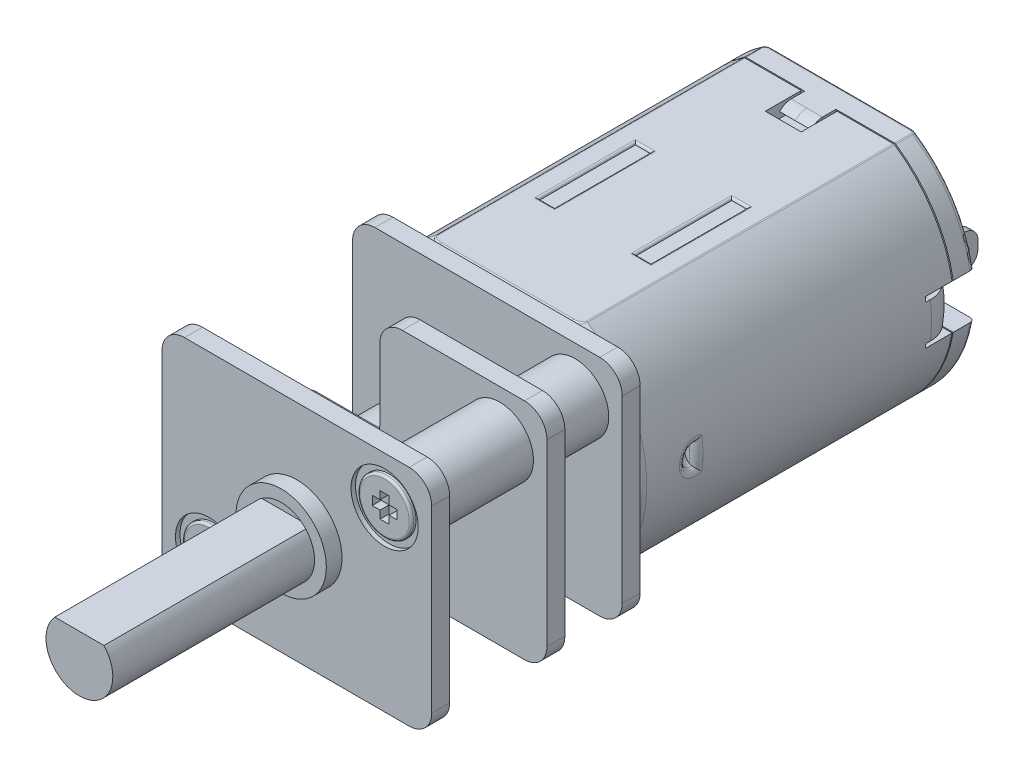
from build123d import *

# Parameters (mm, degrees)
SALIENTE_EXTRUIR2_DEPTH  = 7
SALIENTE_EXTRUIR4_DEPTH  = 0.05
SALIENTE_EXTRUIR5_DEPTH  = 0.95
REDONDEO1_R              = 0.2
CROQUIS4_R               = 2.515
SALIENTE_EXTRUIR6_DEPTH  = 1.15
CROQUIS5_R               = 1
CORTAR_EXTRUIR1_DEPTH    = 0.7
CROQUIS6_W               = 1.6
CROQUIS6_H               = 1.6
CORTAR_EXTRUIR2_DEPTH    = 0.6
CROQUIS9_W               = 1.5
CROQUIS9_H               = 2
CORTAR_EXTRUIR3_DEPTH    = 2.2
CROQUIS12_W              = 0.7
CROQUIS12_H              = 4.3
CORTAR_EXTRUIR4_DEPTH    = 0.1
REDONDEO2_R              = 0.1
CROQUIS13_W              = 0.7
CROQUIS13_H              = 4.3
CORTAR_EXTRUIR5_DEPTH    = 0.1
REDONDEO3_R              = 0.1
CORTAR_REVOLUCI_N2_ANGLE = 180
REDONDEO4_R              = 0.3
REDONDEO5_R              = 0.3
REDONDEO6_R              = 0.3
REDONDEO7_R              = 0.1
REDONDEO8_R              = 0.1
CROQUIS15_W              = 12.03
CROQUIS15_H              = 10
SALIENTE_EXTRUIR8_DEPTH  = 0.8
REDONDEO9_R              = 0.1
CROQUIS16_R              = 1.5
SALIENTE_EXTRUIR9_DEPTH  = 8.5
CROQUIS17_W              = 12.03
CROQUIS17_H              = 10
SALIENTE_EXTRUIR10_DEPTH = 0.8
SALIENTE_EXTRUIR11_DEPTH = 0.8
REDONDEO10_R             = 1
CROQUIS19_R              = 2.015
SALIENTE_EXTRUIR12_DEPTH = 0.7
SALIENTE_EXTRUIR13_START = 2.62
CROQUIS20_R              = 2.015
SALIENTE_EXTRUIR13_DEPTH = 2.62
SALIENTE_EXTRUIR14_DEPTH = 9
CORTAR_EXTRUIR6_START    = -0.2
CROQUIS22_R              = 1.5
CORTAR_EXTRUIR6_DEPTH    = 0.2
CROQUIS23_R              = 1.2
SALIENTE_EXTRUIR15_DEPTH = 0.2
CORTAR_EXTRUIR7_DEPTH    = 0.4
REDONDEO11_R             = 0.1
CORTAR_EXTRUIR8_START    = -0.2
CORTAR_EXTRUIR8_DEPTH    = 0.2
CROQUIS26_W              = 0.3
CROQUIS26_H              = 1.53
SALIENTE_EXTRUIR16_DEPTH = 2
CROQUIS27_W              = 1.2
CROQUIS27_H              = 0.73
CORTAR_EXTRUIR9_DEPTH    = 0.3
REDONDEO12_R             = 0.6
REDONDEO13_R             = 0.4
CORTAR_EXTRUIR10_DEPTH   = 0.3
REDONDEO14_R             = 0.6


# Some blends are built 0.0001 mm under size
with BuildPart() as part:
    # Croquis1 → Saliente-Extruir2 (new, symmetric)
    with BuildSketch(Plane.XY):
        with BuildLine():
            Line((-3.343684345, 5), (3.343684345, 5))
            ThreePointArc((3.343684345, 5), (6.015, 0), (3.343684345, -5))
            Line((3.343684345, -5), (-3.343684345, -5))
            ThreePointArc((-3.343684345, -5), (-6.015, 0), (-3.343684345, 5))
        make_face()
    extrude(amount=SALIENTE_EXTRUIR2_DEPTH, both=True)

    # Croquis2 → Saliente-Extruir4 (add)
    with BuildSketch(Plane(origin=(0, 0, -7), x_dir=(-1, 0, 0), z_dir=(0, 0, -1))):
        with BuildLine():
            Line((-3.091314445, -4.2), (3.091314445, -4.2))
            ThreePointArc((3.091314445, -4.2), (5.215, 0), (3.091314445, 4.2))
            Line((3.091314445, 4.2), (-3.091314445, 4.2))
            ThreePointArc((-3.091314445, 4.2), (-5.215, 0), (-3.091314445, -4.2))
        make_face()
    extrude(amount=SALIENTE_EXTRUIR4_DEPTH)

    # Croquis3 → Saliente-Extruir5 (add)
    with BuildSketch(Plane(origin=(0, 0, -7.05), x_dir=(-1, 0, 0), z_dir=(0, 0, -1))):
        with BuildLine():
            Line((-3.343684345, -5), (3.343684345, -5))
            ThreePointArc((3.343684345, -5), (6.015, 0), (3.343684345, 5))
            Line((3.343684345, 5), (-3.343684345, 5))
            ThreePointArc((-3.343684345, 5), (-6.015, 0), (-3.343684345, -5))
        make_face()
    extrude(amount=SALIENTE_EXTRUIR5_DEPTH)

    # Redondeo1
    redondeo1_edges = [part.edges().sort_by_distance(p)[0] for p in [
        (6.015, 0, -8),
        (-6.015, 0, -8),
    ]]
    fillet(redondeo1_edges, radius=REDONDEO1_R)

    # Croquis4 → Saliente-Extruir6 (add)
    with BuildSketch(Plane(origin=(0, 0, -8), x_dir=(-1, 0, 0), z_dir=(0, 0, -1))):
        Circle(CROQUIS4_R)
    extrude(amount=SALIENTE_EXTRUIR6_DEPTH)

    # Croquis5 → Cortar-Extruir1 (cut)
    with BuildSketch(Plane(origin=(0, 0, -9.15), x_dir=(-1, 0, 0), z_dir=(0, 0, -1))):
        Circle(CROQUIS5_R)
    extrude(amount=-CORTAR_EXTRUIR1_DEPTH, mode=Mode.SUBTRACT)

    # Croquis6 → Cortar-Extruir2 (cut)
    with BuildSketch(Plane(origin=(0, 5, 0), x_dir=(1, 0, 0), z_dir=(0, 1, 0))):
        with Locations((0, 6.2)):
            Rectangle(CROQUIS6_W, CROQUIS6_H)
    extrude(amount=-CORTAR_EXTRUIR2_DEPTH, mode=Mode.SUBTRACT)

    # Barrer1: sweep along a path in Croquis8
    with BuildLine(Plane(origin=(0, 0, 0), x_dir=(0, 0, -1), z_dir=(1, 0, 0))) as barrer1_path:
        Line((7.05, 4.8), (6.45, 4.8))
        ThreePointArc((6.45, 4.8), (6.2516861, 4.756520534), (6.08975411, 4.634058714))
    # Croquis7 → Barrer1 (sweep)
    with BuildSketch(Plane.XY.offset(-7.05)):
        Polygon((0, 5), (-0.7, 5), (-0.7, 4.6), (0.7, 4.6), (0.7, 5), align=None)
    sweep(path=barrer1_path.line)

    # Croquis9 → Cortar-Extruir3 (cut)
    with BuildSketch(Plane(origin=(0, 0, -8), x_dir=(-1, 0, 0), z_dir=(0, 0, -1))):
        with Locations((-5.265, 0)):
            Rectangle(CROQUIS9_W, CROQUIS9_H)
    cortar_extruir3 = extrude(amount=-CORTAR_EXTRUIR3_DEPTH, mode=Mode.SUBTRACT)

    # Barrer2: sweep along a path in Croquis11
    with BuildLine(Plane(origin=(0, 0, 0), x_dir=(1, 0, 0), z_dir=(0, 1, 0))) as barrer2_path:
        Line((5.561562295, 5.8), (5.561562295, 6))
        ThreePointArc((5.561562295, 6), (5.343693941, 6.586560818), (4.795743442, 6.888670836))
    # Croquis10 → Barrer2 (sweep)
    with BuildSketch(Plane(origin=(0, 0, -5.8), x_dir=(-1, 0, 0), z_dir=(0, 0, -1))):
        with BuildLine():
            Line((-5.961562295, 0.8), (-5.161562295, 0.8))
            Line((-5.161562295, 0.8), (-5.161562295, -0.8))
            Line((-5.161562295, -0.8), (-5.961562295, -0.8))
            ThreePointArc((-5.961562295, -0.8), (-6.015, 0), (-5.961562295, 0.8))
        make_face()
    barrer2 = sweep(path=barrer2_path.line)

    # Simetría2: Cortar-Extruir3, Barrer2 across plane
    add(cortar_extruir3.mirror(Plane(origin=(0, 0, 0), x_dir=(0, 0, 1), z_dir=(1, 0, 0))), mode=Mode.SUBTRACT)
    add(barrer2.mirror(Plane(origin=(0, 0, 0), x_dir=(0, 0, 1), z_dir=(1, 0, 0))))

    # Croquis12 → Cortar-Extruir4 (cut)
    with BuildSketch(Plane(origin=(0, 5, 0), x_dir=(1, 0, 0), z_dir=(0, 1, 0))):
        with Locations((-2.15, -0.85)):
            Rectangle(CROQUIS12_W, CROQUIS12_H)
        with Locations((2.15, -0.85)):
            Rectangle(CROQUIS12_W, CROQUIS12_H)
    extrude(amount=-CORTAR_EXTRUIR4_DEPTH, mode=Mode.SUBTRACT)

    # Redondeo2
    redondeo2_edges = [part.edges().sort_by_distance(p)[0] for p in [
        (2.15, 5, 3),
        (2.5, 5, 0.85),
        (1.8, 5, 0.85),
        (2.15, 5, -1.3),
        (-1.8, 5, 0.85),
        (-2.5, 5, 0.85),
        (-2.15, 5, 3),
        (-2.15, 5, -1.3),
    ]]
    fillet(redondeo2_edges, radius=REDONDEO2_R - 0.0001)  # a hair under: the kernel refuses the full size

    # Croquis13 → Cortar-Extruir5 (cut)
    with BuildSketch(Plane.XZ.offset(5)):
        with Locations((2.15, 0.85)):
            Rectangle(CROQUIS13_W, CROQUIS13_H)
        with Locations((-2.15, 0.85)):
            Rectangle(CROQUIS13_W, CROQUIS13_H)
    extrude(amount=-CORTAR_EXTRUIR5_DEPTH, mode=Mode.SUBTRACT)

    # Redondeo3
    redondeo3_edges = [part.edges().sort_by_distance(p)[0] for p in [
        (-2.15, -5, 3),
        (-2.5, -5, 0.85),
        (-2.15, -5, -1.3),
        (-1.8, -5, 0.85),
        (2.15, -5, 3),
        (1.8, -5, 0.85),
        (2.5, -5, 0.85),
        (2.15, -5, -1.3),
    ]]
    fillet(redondeo3_edges, radius=REDONDEO3_R - 0.0001)  # a hair under: the kernel refuses the full size

    # Croquis14 → Cortar-Revolución2 (revolve, cut)
    with BuildSketch(Plane.XY.offset(4.5)):
        with BuildLine():
            Line((5.994325701, 0.498281438), (5.994325701, -0.498281438))
            ThreePointArc((5.994325701, -0.498281438), (5.496044263, 0), (5.994325701, 0.498281438))
        make_face()
    cortar_revoluci_n2 = revolve(axis=Axis((5.994325701, 0.498281438, 4.5), (0, 1, 0)), revolution_arc=CORTAR_REVOLUCI_N2_ANGLE, mode=Mode.SUBTRACT)

    # Redondeo4
    redondeo4_edges = [part.edges().sort_by_distance(p)[0] for p in [
        (6.015, 0, 4.5),
        (6.015, 0, 4.997852353),
    ]]
    fillet(redondeo4_edges, radius=REDONDEO4_R)

    # Simetría10: Cortar-Revolución2 across plane
    add(cortar_revoluci_n2.mirror(Plane(origin=(0, 0, 0), x_dir=(0, 0, 1), z_dir=(1, 0, 0))), mode=Mode.SUBTRACT)

    # Redondeo5
    redondeo5_edges = [part.edges().sort_by_distance(p)[0] for p in [
        (-6.015, 0, 4.5),
        (-6.015, 0, 4.997852353),
    ]]
    fillet(redondeo5_edges, radius=REDONDEO5_R)

    # Redondeo6
    redondeo6_edges = [part.edges().sort_by_distance(p)[0] for p in [
        (-6.015, 0, 7),
        (6.015, 0, 7),
    ]]
    fillet(redondeo6_edges, radius=REDONDEO6_R)

    # Redondeo7
    redondeo7_edges = [part.edges().sort_by_distance(p)[0] for p in [
        (0, 5, 7),
        (-3.343684345, 5, -0.15),
        (3.343684345, 5, -0.15),
        (3.115222831, 5, 6.942903517),
        (-3.115222831, 5, 6.942903517),
    ]]
    fillet(redondeo7_edges, radius=REDONDEO7_R)

    # Redondeo8
    redondeo8_edges = [part.edges().sort_by_distance(p)[0] for p in [
        (0, -5, 7),
        (3.343684345, -5, -0.15),
        (-3.343684345, -5, -0.15),
        (3.115222831, -5, 6.942903517),
        (-3.115222831, -5, 6.942903517),
    ]]
    fillet(redondeo8_edges, radius=REDONDEO8_R)

    # Croquis15 → Saliente-Extruir8 (add)
    with BuildSketch(Plane.XY.offset(7)):
        Rectangle(CROQUIS15_W, CROQUIS15_H)
    extrude(amount=SALIENTE_EXTRUIR8_DEPTH)

    # Redondeo9
    redondeo9_edges = [part.edges().sort_by_distance(p)[0] for p in [
        (0, -5, -8),
        (0, 5, -8),
        (3.343684345, 5, -7.425),
        (-3.343684345, 5, -7.425),
        (3.195717986, 5, -7.960729085),
        (-3.195717986, 5, -7.960729085),
        (-3.343684345, -5, -7.425),
        (3.343684345, -5, -7.425),
        (3.195717986, -5, -7.960729085),
        (-3.195717986, -5, -7.960729085),
    ]]
    fillet(redondeo9_edges, radius=REDONDEO9_R)

    # Croquis16 → Saliente-Extruir9 (add)
    with BuildSketch(Plane.XY.offset(7.8)):
        with Locations(Location((3.915, 2.9, 0), (0, 0, 180))):
            Circle(CROQUIS16_R)
        with Locations(Location((-3.915, -2.9, 0), (0, 0, 180))):
            Circle(CROQUIS16_R)
    extrude(amount=SALIENTE_EXTRUIR9_DEPTH)

    # Croquis17 → Saliente-Extruir10 (add)
    with BuildSketch(Plane.XY.offset(16.3)):
        Rectangle(CROQUIS17_W, CROQUIS17_H)
    extrude(amount=-SALIENTE_EXTRUIR10_DEPTH)

    # Croquis18 → Saliente-Extruir11 (add)
    with BuildSketch(Plane.XY.offset(11.16)):
        Polygon((-6.015, -0.09), (-1.435, -0.09), (-1.435, 5), (6.015, 5), (6.015, -5), (-6.015, -5), align=None)
    extrude(amount=-SALIENTE_EXTRUIR11_DEPTH)

    # Redondeo10
    redondeo10_edges = [part.edges().sort_by_distance(p)[0] for p in [
        (6.015, -5, 7.4),
        (6.015, 5, 7.4),
        (-6.015, 5, 7.4),
        (-6.015, -5, 7.4),
        (6.015, -5, 15.9),
        (-6.015, -5, 15.9),
        (-6.015, 5, 15.9),
        (6.015, 5, 15.9),
        (6.015, -5, 10.76),
        (-6.015, -5, 10.76),
        (-6.015, -0.09, 10.76),
        (-1.435, -0.09, 10.76),
        (-1.435, 5, 10.76),
        (6.015, 5, 10.76),
    ]]
    fillet(redondeo10_edges, radius=REDONDEO10_R)

    # Croquis19 → Saliente-Extruir12 (add)
    with BuildSketch(Plane.XY.offset(16.3)):
        Circle(CROQUIS19_R)
    extrude(amount=SALIENTE_EXTRUIR12_DEPTH)

    # Croquis20 → Saliente-Extruir13 (add)
    with BuildSketch(Plane(origin=(0, 0, 15.5), x_dir=(-1, 0, 0), z_dir=(0, 0, -1)).offset(SALIENTE_EXTRUIR13_START)):
        with Locations(Location((0, 0, 0), (0, 0, 180))):
            Circle(CROQUIS20_R)
    extrude(amount=-SALIENTE_EXTRUIR13_DEPTH)

    # Croquis21 → Saliente-Extruir14 (add)
    with BuildSketch(Plane.XY.offset(17)):
        with BuildLine():
            Line((-1.095445115, 1.01), (1.095445115, 1.01))
            ThreePointArc((1.095445115, 1.01), (0, -1.49), (-1.095445115, 1.01))
        make_face()
    extrude(amount=SALIENTE_EXTRUIR14_DEPTH)

    # Croquis22 → Cortar-Extruir6 (cut)
    with BuildSketch(Plane.XY.offset(16.3).offset(CORTAR_EXTRUIR6_START)):
        with Locations(Location((3.915, 2.9, 0), (0, 0, 180))):
            Circle(CROQUIS22_R)
        with Locations(Location((-3.915, -2.9, 0), (0, 0, 180))):
            Circle(CROQUIS22_R)
    extrude(amount=CORTAR_EXTRUIR6_DEPTH, mode=Mode.SUBTRACT)

    # Croquis23 → Saliente-Extruir15 (add)
    with BuildSketch(Plane.XY.offset(16.1)):
        with Locations((3.915, 2.9)):
            Circle(CROQUIS23_R)
        with Locations((-3.915, -2.9)):
            Circle(CROQUIS23_R)
    extrude(amount=SALIENTE_EXTRUIR15_DEPTH)

    # Croquis24 → Cortar-Extruir7 (cut)
    with BuildSketch(Plane.XY.offset(16.3)):
        Polygon((-4.465, -3.1), (-4.115, -3.1), (-4.115, -3.45), (-3.715, -3.45), (-3.715, -3.1), (-3.365, -3.1), (-3.365, -2.7), (-3.715, -2.7), (-3.715, -2.35), (-4.115, -2.35), (-4.115, -2.7), (-4.465, -2.7), align=None)
        Polygon((3.365, 2.7), (3.715, 2.7), (3.715, 2.35), (4.115, 2.35), (4.115, 2.7), (4.465, 2.7), (4.465, 3.1), (4.115, 3.1), (4.115, 3.45), (3.715, 3.45), (3.715, 3.1), (3.365, 3.1), align=None)
    extrude(amount=-CORTAR_EXTRUIR7_DEPTH, mode=Mode.SUBTRACT)

    # Redondeo11
    redondeo11_edges = [part.edges().sort_by_distance(p)[0] for p in [
        (2.715, 2.9, 16.3),
        (-5.115, -2.9, 16.3),
    ]]
    fillet(redondeo11_edges, radius=REDONDEO11_R)

    # Croquis25 → Cortar-Extruir8 (cut)
    with BuildSketch(Plane.XY.offset(17).offset(CORTAR_EXTRUIR8_START)):
        with BuildLine():
            Line((1.095445115, 1.01), (-1.095445115, 1.01))
            ThreePointArc((-1.095445115, 1.01), (0, 1.49), (1.095445115, 1.01))
        make_face()
    extrude(amount=CORTAR_EXTRUIR8_DEPTH, mode=Mode.SUBTRACT)

    # Croquis26 → Saliente-Extruir16 (add)
    with BuildSketch(Plane(origin=(0, 0, -8), x_dir=(-1, 0, 0), z_dir=(0, 0, -1))):
        with Locations((-3.935, 0)):
            Rectangle(CROQUIS26_W, CROQUIS26_H)
        with Locations((3.935, 0)):
            Rectangle(CROQUIS26_W, CROQUIS26_H)
    extrude(amount=SALIENTE_EXTRUIR16_DEPTH)

    # Croquis27 → Cortar-Extruir9 (cut)
    with BuildSketch(Plane(origin=(4.085, 0, 0), x_dir=(0, 0, -1), z_dir=(1, 0, 0))):
        with Locations((9, 0)):
            Rectangle(CROQUIS27_W, CROQUIS27_H)
    extrude(amount=-CORTAR_EXTRUIR9_DEPTH, mode=Mode.SUBTRACT)

    # Redondeo12
    redondeo12_edges = [part.edges().sort_by_distance(p)[0] for p in [
        (3.935, -0.765, -10),
        (3.935, 0.765, -10),
    ]]
    fillet(redondeo12_edges, radius=REDONDEO12_R)

    # Redondeo13
    # the kernel refuses this fillet: 0.4 mm, written as the material it adds along each edge
    with BuildSketch(Plane(origin=(4.085, 0.365, -8.4), x_dir=(0, 0, -1), z_dir=(-1, 0, 0))) as redondeo13_piece_1:
        with BuildLine():
            CenterArc((REDONDEO13_R, REDONDEO13_R), REDONDEO13_R, 180, 90)
            Line((0, REDONDEO13_R), (0, 0))
            Line((0, 0), (REDONDEO13_R, 0))
        make_face()
    extrude(amount=0.3)
    with BuildSketch(Plane(origin=(4.085, -0.365, -8.4), x_dir=(0, 0, -1), z_dir=(-1, 0, 0)), Plane(origin=(4.085, -0.365, -9.6), x_dir=(0, 1, 0), z_dir=(-1, 0, 0)), Plane(origin=(4.085, 0.365, -9.6), x_dir=(0, 0, 1), z_dir=(-1, 0, 0))) as redondeo13_piece_2:
        with BuildLine():
            CenterArc((REDONDEO13_R, -REDONDEO13_R), REDONDEO13_R, 90, 90)
            Line((0, -REDONDEO13_R), (0, 0))
            Line((0, 0), (REDONDEO13_R, 0))
        make_face()
    extrude(amount=0.3)

    # Croquis28 → Cortar-Extruir10 (cut)
    with BuildSketch(Plane(origin=(-3.785, 0, 0), x_dir=(0, 0, -1), z_dir=(1, 0, 0))):
        with BuildLine():
            Line((9.2, 0.365), (8.8, 0.365))
            ThreePointArc((8.8, 0.365), (8.529814878, 0.259957624), (8.401534192, 0))
            ThreePointArc((8.401534192, 0), (8.529814878, -0.259957624), (8.8, -0.365))
            Line((8.8, -0.365), (9.2, -0.365))
            ThreePointArc((9.2, -0.365), (9.470185122, -0.259957624), (9.598465808, 0))
            ThreePointArc((9.598465808, 0), (9.470185122, 0.259957624), (9.2, 0.365))
        make_face()
    extrude(amount=-CORTAR_EXTRUIR10_DEPTH, mode=Mode.SUBTRACT)

    # Redondeo14
    redondeo14_edges = [part.edges().sort_by_distance(p)[0] for p in [
        (-3.935, -0.765, -10),
        (-3.935, 0.765, -10),
    ]]
    fillet(redondeo14_edges, radius=REDONDEO14_R)


solid = part.part
